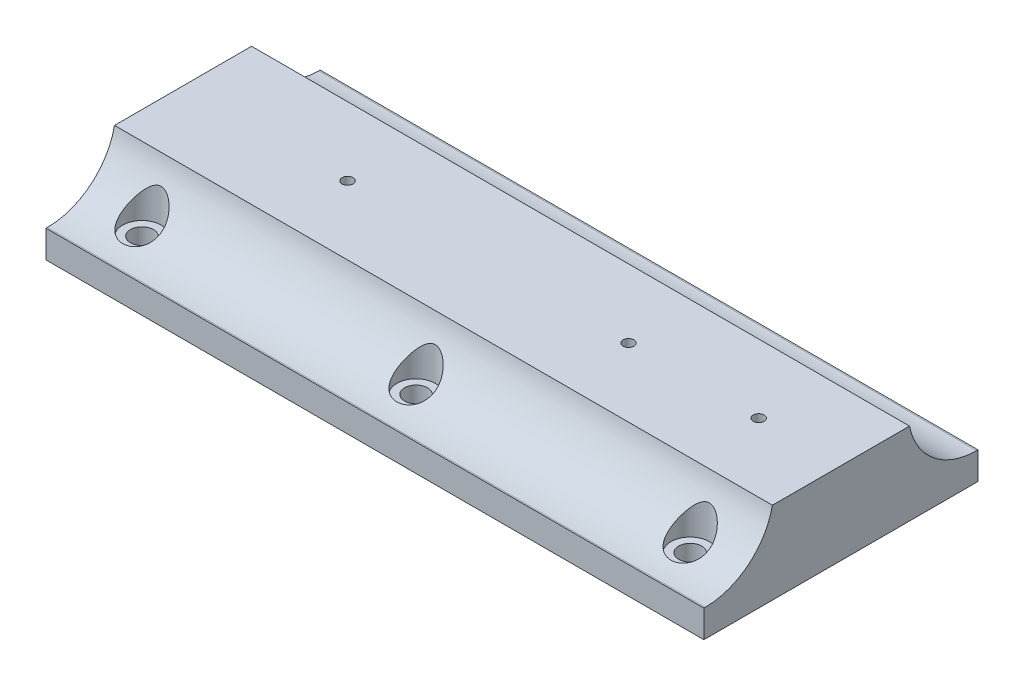
from build123d import *

# Parameters (mm, degrees)
SKETCH2_W                       = 120
SKETCH2_H                       = 50
BOSS_EXTRUDE1_DEPTH             = 15
AUFSATZ_LINEAR_START            = 47.5
AUFSATZ_LINEAR_AUSTRAGEN3_DEPTH = 47.5
SCHNITT_LINEAR_START            = 35
SKIZZE7_R                       = 7.5
SCHNITT_LINEAR_AUSTRAGEN2_DEPTH = 12.5
SCHNITT_LINEAR_START_2          = 10
SKIZZE7_2_R                     = 7.5
SCHNITT_LINEAR_AUSTRAGEN3_DEPTH = 10
SCHNITT_LINEAR_AUSTRAGEN4_REACH = 84.234
SKIZZE8_R                       = 1
SCHNITT_LINEAR_AUSTRAGEN5_DEPTH = 126.77149982
SKIZZE10_R                      = 2.1
SCHNITT_LINEAR_AUSTRAGEN7_DEPTH = 82.469960946
SPIEGELN3_COPY_1_SKETCH_R       = 2.1
SPIEGELN3_COPY_1_DEPTH          = 82.469960946
SKIZZE12_R                      = 2.1
SCHNITT_LINEAR_AUSTRAGEN8_DEPTH = 10
FILLET1_R                       = 12.5
FILLET2_R                       = 12.5
SKETCH4_R                       = 3.5
CUT_EXTRUDE1_DEPTH              = 20


with BuildPart() as part:
    # Sketch2 → Boss-Extrude1 (new body)
    with BuildSketch(Plane(origin=(0, 0, 0), x_dir=(1, 0, 0), z_dir=(0, 1, 0))):
        with Locations((13.101876656, 9.54663752)):
            Rectangle(SKETCH2_W, SKETCH2_H)
    extrude(amount=BOSS_EXTRUDE1_DEPTH)

    # Sketch3 → Cut-Revolve8 (revolve, cut)
    with BuildSketch(Plane(origin=(0, 0, 0), x_dir=(1, 0, 0), z_dir=(0, 1, 0))):
        Polygon((63.101876656, 9.54663752), (63.101876656, 17.04663752), (3.101876656, 17.04663752), (3.101876656, 19.54663752), (-36.898123344, 19.54663752), (-36.898123344, 9.54663752), align=None)
    revolve(axis=Axis((74.354835368, 0, -9.54663752), (-1, 0, 0)), mode=Mode.SUBTRACT)

    # Skizze2 → Aufsatz-Linear austragen3 (add)
    with BuildSketch(Plane.ZY.offset(-63.101876656).offset(AUFSATZ_LINEAR_START)):
        with BuildLine():
            Line((-4.546629414, 0), (-2.04663752, 0))
            ThreePointArc((-2.04663752, 0), (-2.750864918, 3.172928416), (-4.731297449, 5.75))
            Line((-4.731297449, 5.75), (-6.332422054, 3.83))
            ThreePointArc((-6.332422054, 3.83), (-5.015016152, 2.112933704), (-4.546629414, 0))
        make_face()
    aufsatz_linear_austragen3 = extrude(amount=-AUFSATZ_LINEAR_AUSTRAGEN3_DEPTH)

    # Spiegeln1: Aufsatz-Linear austragen3 across plane
    add(aufsatz_linear_austragen3.mirror(Plane.XY.offset(-9.54663752)))

    # Skizze7 → Schnitt-Linear austragen2 (cut)
    with BuildSketch(Plane.ZY.offset(-63.101876656).offset(SCHNITT_LINEAR_START)):
        with Locations((-9.54663752, 0)):
            Circle(SKIZZE7_R)
    extrude(amount=-SCHNITT_LINEAR_AUSTRAGEN2_DEPTH, mode=Mode.SUBTRACT)

    # Skizze7<2> → Schnitt-Linear austragen3 (cut)
    with BuildSketch(Plane.ZY.offset(-63.101876656).offset(SCHNITT_LINEAR_START_2)):
        with Locations((-9.54663752, 0)):
            Circle(SKIZZE7_2_R)
    extrude(amount=-SCHNITT_LINEAR_AUSTRAGEN3_DEPTH, mode=Mode.SUBTRACT)

    # Skizze8 → Schnitt-Linear austragen4 (cut, up to next)
    with BuildSketch(Plane(origin=(0, 15, 0), x_dir=(1, 0, 0), z_dir=(0, 1, 0)), mode=Mode.PRIVATE) as schnitt_linear_austragen4_sk1:
        with Locations(Location((58.101876656, 9.54663752, 0), (0, 0, 270))):
            Circle(SKIZZE8_R)
    schnitt_linear_austragen4_tool1 = extrude(schnitt_linear_austragen4_sk1.sketch, amount=-SCHNITT_LINEAR_AUSTRAGEN4_REACH, mode=Mode.PRIVATE) & part.part
    # Skizze8 → Schnitt-Linear austragen4 (cut, up to next)
    with BuildSketch(Plane(origin=(0, 15, 0), x_dir=(1, 0, 0), z_dir=(0, 1, 0)), mode=Mode.PRIVATE) as schnitt_linear_austragen4_sk2:
        with Locations(Location((34.351876656, 9.54663752, 0), (0, 0, 270))):
            Circle(SKIZZE8_R)
    schnitt_linear_austragen4_tool2 = extrude(schnitt_linear_austragen4_sk2.sketch, amount=-SCHNITT_LINEAR_AUSTRAGEN4_REACH, mode=Mode.PRIVATE) & part.part
    # Skizze8 → Schnitt-Linear austragen4 (cut, up to next)
    with BuildSketch(Plane(origin=(0, 15, 0), x_dir=(1, 0, 0), z_dir=(0, 1, 0)), mode=Mode.PRIVATE) as schnitt_linear_austragen4_sk3:
        with Locations(Location((-16.898123344, 9.54663752, 0), (0, 0, 270))):
            Circle(SKIZZE8_R)
    schnitt_linear_austragen4_tool3 = extrude(schnitt_linear_austragen4_sk3.sketch, amount=-SCHNITT_LINEAR_AUSTRAGEN4_REACH, mode=Mode.PRIVATE) & part.part
    add(schnitt_linear_austragen4_tool1.solids().sort_by_distance((58.101877, 15, -9.546638))[0], mode=Mode.SUBTRACT)
    add(schnitt_linear_austragen4_tool2.solids().sort_by_distance((34.351877, 15, -9.546638))[0], mode=Mode.SUBTRACT)
    add(schnitt_linear_austragen4_tool3.solids().sort_by_distance((-16.898123, 15, -9.546638))[0], mode=Mode.SUBTRACT)

    # Skizze9 → Schnitt-Linear austragen5 (cut, through all)
    with BuildSketch(Plane.ZY.offset(46.898123344)):
        Polygon((-34.54663752, 5), (-22.04663752, 5), (-22.04663752, 15), (2.95336248, 15), (2.95336248, 5), (15.45336248, 5), (15.45336248, 15), (-34.54663752, 15), align=None)
    extrude(amount=-SCHNITT_LINEAR_AUSTRAGEN5_DEPTH, mode=Mode.SUBTRACT)

    # Skizze10 → Schnitt-Linear austragen7 (cut, through all)
    with BuildSketch(Plane(origin=(0, 5, 0), x_dir=(1, 0, 0), z_dir=(0, 1, 0))):
        with Locations(Location((63.101876656, 27.04663752, 0), (0, 0, 270))):
            Circle(SKIZZE10_R)
    schnitt_linear_austragen7 = extrude(amount=-SCHNITT_LINEAR_AUSTRAGEN7_DEPTH, mode=Mode.SUBTRACT)

    # Spiegeln2: Schnitt-Linear austragen7 across plane
    add(schnitt_linear_austragen7.mirror(Plane.XY.offset(-9.54663752)), mode=Mode.SUBTRACT)

    # Spiegeln3: Schnitt-Linear austragen7 across plane
    add(schnitt_linear_austragen7.mirror(Plane(origin=(13.101876656, 0, 0), x_dir=(0, 0, 1), z_dir=(1, 0, 0))), mode=Mode.SUBTRACT)

    # Spiegeln3 copy 1 sketch → Spiegeln3 copy 1 (cut, through all)
    with BuildSketch(Plane(origin=(26.203753312, 5, -19.09327504), x_dir=(-1, 0, 0), z_dir=(0, 1, 0))):
        with Locations(Location((63.101876656, 27.04663752, 0), (0, 0, 270))):
            Circle(SPIEGELN3_COPY_1_SKETCH_R)
    extrude(amount=-SPIEGELN3_COPY_1_DEPTH, mode=Mode.SUBTRACT)

    # Skizze12 → Schnitt-Linear austragen8 (cut)
    with BuildSketch(Plane(origin=(0, 5, 0), x_dir=(1, 0, 0), z_dir=(0, 1, 0))):
        with Locations(Location((13.101876656, 27.04663752, 0), (0, 0, 270))):
            Circle(SKIZZE12_R)
        with Locations(Location((13.101876656, -7.95336248, 0), (0, 0, 270))):
            Circle(SKIZZE12_R)
    extrude(amount=-SCHNITT_LINEAR_AUSTRAGEN8_DEPTH, mode=Mode.SUBTRACT)

    # Fillet1
    # the kernel refuses this fillet: 12.5 mm, written as the material it adds along each edge
    with BuildSketch(Plane(origin=(-46.898123344, 5, 2.95336248), x_dir=(0, 0, 1), z_dir=(1, 0, 0))) as fillet1_piece_1_section:
        with BuildLine():
            CenterArc((12.247448714, -12.5), FILLET1_R, 90, 78.463040967)
            Line((0, -10), (-0.244948974, -9.95))
            ThreePointArc((-0.244948974, -9.95), (-0.25, -5), (-0.25, 0))
            Line((-0.25, 0), (0, 0.25))
            Line((0, 0.25), (12.247448714, 0.25))
            Line((12.247448714, 0.25), (12.247448714, 0))
        make_face()
    fillet1_piece_1 = extrude(amount=120, mode=Mode.PRIVATE)
    fillet1_piece_1 = fillet1_piece_1 - Plane(origin=(63.101876656, 7.52839173, 7.95336248), x_dir=(0, 0, -1), z_dir=(0, 1, 0)) * Cylinder(2.1, 289, mode=Mode.PRIVATE)
    fillet1_piece_1 = fillet1_piece_1 - Plane(origin=(-36.898123344, 7.52839173, 7.95336248), x_dir=(0, 0, -1), z_dir=(0, 1, 0)) * Cylinder(2.1, 289, mode=Mode.PRIVATE)
    fillet1_piece_1 = fillet1_piece_1 - Plane(origin=(13.101876656, 7.52839173, 7.95336248), x_dir=(0, 0, 1), z_dir=(0, 1, 0)) * Cylinder(2.1, 289, mode=Mode.PRIVATE)
    add(fillet1_piece_1)

    # Fillet2
    # the kernel refuses this fillet: 12.5 mm, written as the material it adds along each edge
    with BuildSketch(Plane(origin=(-46.898123344, 5, -22.04663752), x_dir=(0, 0, -1), z_dir=(1, 0, 0))) as fillet2_piece_1_section:
        with BuildLine():
            CenterArc((12.247448714, 12.5), FILLET2_R, 191.536959033, 78.463040967)
            Line((0, 10), (-0.244948974, 9.95))
            ThreePointArc((-0.244948974, 9.95), (-0.25, 5), (-0.25, 0))
            Line((-0.25, 0), (0, -0.25))
            Line((0, -0.25), (12.247448714, -0.25))
            Line((12.247448714, -0.25), (12.247448714, 0))
        make_face()
    fillet2_piece_1 = extrude(amount=120, mode=Mode.PRIVATE)
    fillet2_piece_1 = fillet2_piece_1 - Plane(origin=(63.101876656, 7.528391761, -27.04663752), x_dir=(0, 0, 1), z_dir=(0, 1, 0)) * Cylinder(2.1, 289, mode=Mode.PRIVATE)
    fillet2_piece_1 = fillet2_piece_1 - Plane(origin=(-36.898123344, 7.528391761, -27.04663752), x_dir=(0, 0, 1), z_dir=(0, 1, 0)) * Cylinder(2.1, 289, mode=Mode.PRIVATE)
    fillet2_piece_1 = fillet2_piece_1 - Plane(origin=(13.101876656, 7.528391761, -27.04663752), x_dir=(0, 0, 1), z_dir=(0, 1, 0)) * Cylinder(2.1, 289, mode=Mode.PRIVATE)
    add(fillet2_piece_1)

    # Sketch4 → Cut-Extrude1 (cut)
    with BuildSketch(Plane(origin=(0, 25, 0), x_dir=(1, 0, 0), z_dir=(0, 1, 0))):
        with Locations(Location((63.101876656, 27.04663752, 0), (0, 0, 270))):
            Circle(SKETCH4_R)
        with Locations(Location((13.101876656, 27.04663752, 0), (0, 0, 270))):
            Circle(SKETCH4_R)
        with Locations(Location((-36.898123344, 27.04663752, 0), (0, 0, 270))):
            Circle(SKETCH4_R)
        with Locations(Location((-36.898123344, -7.95336248, 0), (0, 0, 270))):
            Circle(SKETCH4_R)
        with Locations(Location((13.101876656, -7.95336248, 0), (0, 0, 270))):
            Circle(SKETCH4_R)
        with Locations(Location((63.101876656, -7.95336248, 0), (0, 0, 270))):
            Circle(SKETCH4_R)
    extrude(amount=-CUT_EXTRUDE1_DEPTH, mode=Mode.SUBTRACT)


solid = part.part
